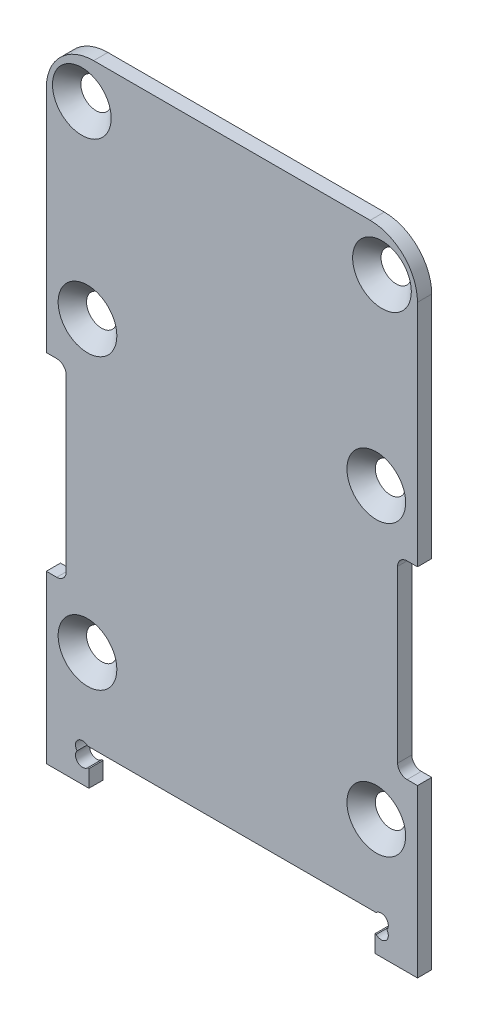
from build123d import *

# Parameters (mm, degrees)
BASE_DEPTH                                 = 1.5
BATTERY_STRAP_CUT_REACH                    = 45.853
SKETCH3_W                                  = 2.1
SKETCH3_H                                  = 20
BATTERY_STRAP_FILLET_R                     = 1
BATTERY_STRAP_FILLET_OF_BATTERY_STRAP_OT_R = 1
FILLET2_R                                  = 5
HOLE_CUT_REACH                             = 45.853
SKETCH2_R                                  = 1.6
BOLT_HEAD_CHAMBER_SIZE                     = 1.5
SKETCH4_R                                  = 0.75
MILLING_HOLES_DEPTH                        = 10


with BuildPart() as part:
    # Sketch1 → Base (new body)
    with BuildSketch(Plane.XY):
        Polygon((-19.6, 39.2), (19.6, 39.2), (19.6, -27.6), (15.1, -27.6), (15.1, -25.8), (16.3, -25.8), (16.3, -23.8), (-16.3, -23.8), (-16.3, -25.8), (-15.1, -25.8), (-15.1, -27.6), (-19.6, -27.6), align=None)
    extrude(amount=BASE_DEPTH)

    # Sketch3 → Battery strap cut (cut, up to next)
    with BuildSketch(Plane.XY.offset(1.5), mode=Mode.PRIVATE) as battery_strap_cut_sk1:
        with Locations((-18.55, 0)):
            Rectangle(SKETCH3_W, SKETCH3_H)
    battery_strap_cut_tool1 = extrude(battery_strap_cut_sk1.sketch, amount=-BATTERY_STRAP_CUT_REACH, mode=Mode.PRIVATE) & part.part
    battery_strap_cut = battery_strap_cut_tool1.solids().sort_by_distance((-18.55, 0, 1.5))[0]
    add(battery_strap_cut, mode=Mode.SUBTRACT)

    # Battery strap fillet
    battery_strap_fillet_edges = [part.edges().sort_by_distance(p)[0] for p in [
        (-17.5, 10, 0.75),
        (-17.5, -10, 0.75),
    ]]
    fillet(battery_strap_fillet_edges, radius=BATTERY_STRAP_FILLET_R)

    # Battery strap other side: Battery strap cut across plane
    add(battery_strap_cut.mirror(Plane(origin=(0, 0, 0), x_dir=(0, 0, 1), z_dir=(1, 0, 0))), mode=Mode.SUBTRACT)

    # Battery strap fillet of Battery strap ot
    battery_strap_fillet_of_battery_strap_ot_edges = [part.edges().sort_by_distance(p)[0] for p in [
        (17.5, 10, 0.75),
        (17.5, -10, 0.75),
    ]]
    fillet(battery_strap_fillet_of_battery_strap_ot_edges, radius=BATTERY_STRAP_FILLET_OF_BATTERY_STRAP_OT_R)

    # Fillet2
    fillet2_edges = [part.edges().sort_by_distance(p)[0] for p in [
        (-19.6, 39.2, 0.75),
        (19.6, 39.2, 0.75),
    ]]
    fillet(fillet2_edges, radius=FILLET2_R)

    # Sketch2 → Hole cut (cut, up to next)
    with BuildSketch(Plane.XY.offset(1.5), mode=Mode.PRIVATE) as hole_cut_sk1:
        with Locations((-15.25, 15.25)):
            Circle(SKETCH2_R)
    hole_cut_tool1 = extrude(hole_cut_sk1.sketch, amount=-HOLE_CUT_REACH, mode=Mode.PRIVATE) & part.part
    # Sketch2 → Hole cut (cut, up to next)
    with BuildSketch(Plane.XY.offset(1.5), mode=Mode.PRIVATE) as hole_cut_sk2:
        with Locations((-15.85, 34.85)):
            Circle(SKETCH2_R)
    hole_cut_tool2 = extrude(hole_cut_sk2.sketch, amount=-HOLE_CUT_REACH, mode=Mode.PRIVATE) & part.part
    # Sketch2 → Hole cut (cut, up to next)
    with BuildSketch(Plane.XY.offset(1.5), mode=Mode.PRIVATE) as hole_cut_sk3:
        with Locations((15.85, 34.85)):
            Circle(SKETCH2_R)
    hole_cut_tool3 = extrude(hole_cut_sk3.sketch, amount=-HOLE_CUT_REACH, mode=Mode.PRIVATE) & part.part
    # Sketch2 → Hole cut (cut, up to next)
    with BuildSketch(Plane.XY.offset(1.5), mode=Mode.PRIVATE) as hole_cut_sk4:
        with Locations((15.25, 15.25)):
            Circle(SKETCH2_R)
    hole_cut_tool4 = extrude(hole_cut_sk4.sketch, amount=-HOLE_CUT_REACH, mode=Mode.PRIVATE) & part.part
    # Sketch2 → Hole cut (cut, up to next)
    with BuildSketch(Plane.XY.offset(1.5), mode=Mode.PRIVATE) as hole_cut_sk5:
        with Locations((15.25, -15.25)):
            Circle(SKETCH2_R)
    hole_cut_tool5 = extrude(hole_cut_sk5.sketch, amount=-HOLE_CUT_REACH, mode=Mode.PRIVATE) & part.part
    # Sketch2 → Hole cut (cut, up to next)
    with BuildSketch(Plane.XY.offset(1.5), mode=Mode.PRIVATE) as hole_cut_sk6:
        with Locations((-15.25, -15.25)):
            Circle(SKETCH2_R)
    hole_cut_tool6 = extrude(hole_cut_sk6.sketch, amount=-HOLE_CUT_REACH, mode=Mode.PRIVATE) & part.part
    add(hole_cut_tool1.solids().sort_by_distance((-15.25, 15.25, 1.5))[0], mode=Mode.SUBTRACT)
    add(hole_cut_tool2.solids().sort_by_distance((-15.85, 34.85, 1.5))[0], mode=Mode.SUBTRACT)
    add(hole_cut_tool3.solids().sort_by_distance((15.85, 34.85, 1.5))[0], mode=Mode.SUBTRACT)
    add(hole_cut_tool4.solids().sort_by_distance((15.25, 15.25, 1.5))[0], mode=Mode.SUBTRACT)
    add(hole_cut_tool5.solids().sort_by_distance((15.25, -15.25, 1.5))[0], mode=Mode.SUBTRACT)
    add(hole_cut_tool6.solids().sort_by_distance((-15.25, -15.25, 1.5))[0], mode=Mode.SUBTRACT)

    # Bolt head chamber
    bolt_head_chamber_edges = [part.edges().sort_by_distance(p)[0] for p in [
        (-16.85, 15.25, 1.5),
        (-17.45, 34.85, 1.5),
        (14.25, 34.85, 1.5),
        (13.65, 15.25, 1.5),
        (13.65, -15.25, 1.5),
        (-16.85, -15.25, 1.5),
    ]]
    chamfer(bolt_head_chamber_edges, length=BOLT_HEAD_CHAMBER_SIZE - 0.0001)  # a hair under: the kernel refuses the full size

    # Sketch4 → Milling holes (cut)
    with BuildSketch(Plane.XY.offset(1.5)):
        with Locations((-15.769669914, -24.330330086)):
            Circle(SKETCH4_R)
        with Locations((-15.769669914, -25.269669914)):
            Circle(SKETCH4_R)
        with Locations((15.769669914, -25.269669914)):
            Circle(SKETCH4_R)
        with Locations((15.769669914, -24.330330086)):
            Circle(SKETCH4_R)
    extrude(amount=-MILLING_HOLES_DEPTH, mode=Mode.SUBTRACT)


solid = part.part
